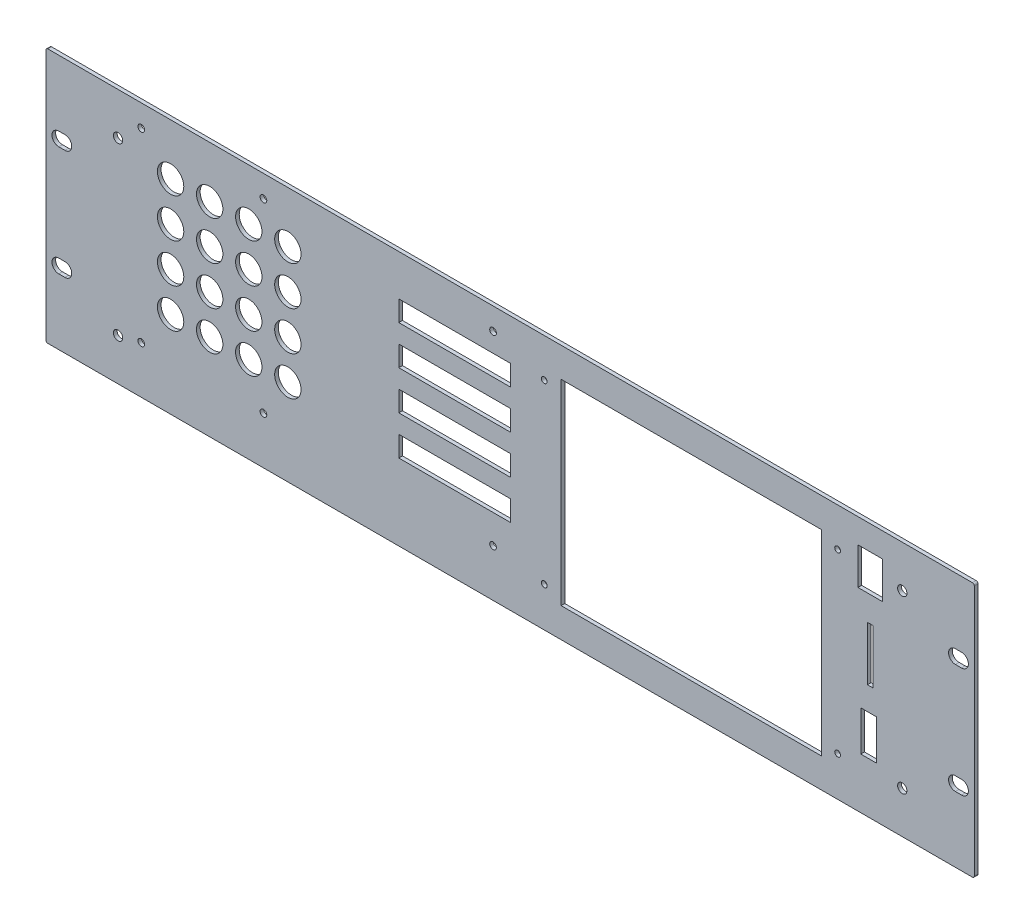
from build123d import *

# Parameters (mm, degrees)
FRONT_PANEL_DEPTH                = 1.905
SKETCH5_R                        = 2.4257
SKETCH5_R_2                      = 2.0701
FRONT_PANEL_MOUNTING_HOLES_DEPTH = 1.905
RACK_MOUNTING_SLOT_DEPTH         = 1.905
ADIO_MOUNTING_HOLES_R            = 1.7399
CUT_EXTRUDE1_DEPTH               = 2.54
SKETCH8_R                        = 6.858
BNC_SEED_HOLE_DEPTH              = 2.54
BNC_PATTERN_COUNT                = 4
BNC_PATTERN_PITCH                = 20.32
BNC_PATTERN_COUNT_DIR2           = 4
BNC_PATTERN_PITCH_DIR2           = 20.32
SKETCH9_W                        = 58.039
SKETCH9_H                        = 10.668
DIO_SEED_HOLE_DEPTH              = 2.54
DIO_PATTERN_COUNT                = 4
DIO_PATTERN_PITCH                = 20.32
LCD_VIEW_CUTOUT_W                = 135.46
LCD_VIEW_CUTOUT_H                = 101.9
LCD_CUTOUT_DEPTH                 = 2.54
LCD_MOUNT_HOLES_R                = 1.5
LCD_MOUNT_HOLE_CUT_DEPTH         = 2.54
SKETCH10_W                       = 12.9
SKETCH10_H                       = 19.2
POWER_SW_CUT_DEPTH               = 12.03
SKETCH11_W                       = 2.935387627
SKETCH11_H                       = 28.1
SKETCH11_W_2                     = 8.128
SKETCH11_H_2                     = 20.828
CUT_EXTRUDE8_DEPTH               = 2.54


# Sheet-metal steps are written as plain solids
with BuildPart() as part:
    # Sketch1 → Front Panel (new body)
    with BuildSketch(Plane.XY):
        with BuildLine():
            Line((1.016, 0), (481.584, 0))
            ThreePointArc((481.584, 0), (482.30242049, 0.29757951), (482.6, 1.016))
            Line((482.6, 1.016), (482.6, 131.572))
            ThreePointArc((482.6, 131.572), (482.30242049, 132.29042049), (481.584, 132.588))
            Line((481.584, 132.588), (1.016, 132.588))
            ThreePointArc((1.016, 132.588), (0.29757951, 132.29042049), (0, 131.572))
            Line((0, 131.572), (0, 1.016))
            ThreePointArc((0, 1.016), (0.29757951, 0.29757951), (1.016, 0))
        make_face()
    extrude(amount=FRONT_PANEL_DEPTH)

    # Sketch5 → Front Panel Mounting Holes (cut)
    with BuildSketch(Plane.XY.offset(1.905)):
        with Locations((445.135, 21.844)):
            Circle(SKETCH5_R)
        with Locations((37.465, 21.844)):
            Circle(SKETCH5_R)
        with Locations((37.465, 110.744)):
            Circle(SKETCH5_R)
        with Locations((445.135, 110.744)):
            Circle(SKETCH5_R)
        with Locations((241.3, -19.907000064)):
            Circle(SKETCH5_R_2)
    extrude(amount=-FRONT_PANEL_MOUNTING_HOLES_DEPTH, mode=Mode.SUBTRACT)

    # Sketch2 → Rack Mounting Slot (cut)
    with BuildSketch(Plane.XY.offset(1.905)):
        with BuildLine():
            Line((472.7575, 34.1503), (475.9579, 34.1503))
            ThreePointArc((475.9579, 34.1503), (479.5012, 37.6936), (475.9579, 41.2369))
            Line((475.9579, 41.2369), (472.7575, 41.2369))
            ThreePointArc((472.7575, 41.2369), (469.2142, 37.6936), (472.7575, 34.1503))
        make_face()
        with BuildLine():
            Line((9.8425, 98.4377), (6.6421, 98.4377))
            ThreePointArc((6.6421, 98.4377), (3.0988, 94.8944), (6.6421, 91.3511))
            Line((6.6421, 91.3511), (9.8425, 91.3511))
            ThreePointArc((9.8425, 91.3511), (13.3858, 94.8944), (9.8425, 98.4377))
        make_face()
        with BuildLine():
            Line((6.6421, 41.2369), (9.8425, 41.2369))
            ThreePointArc((9.8425, 41.2369), (13.3858, 37.6936), (9.8425, 34.1503))
            Line((9.8425, 34.1503), (6.6421, 34.1503))
            ThreePointArc((6.6421, 34.1503), (3.0988, 37.6936), (6.6421, 41.2369))
        make_face()
        with BuildLine():
            Line((475.9579, 91.3511), (472.7575, 91.3511))
            ThreePointArc((472.7575, 91.3511), (469.2142, 94.8944), (472.7575, 98.4377))
            Line((472.7575, 98.4377), (475.9579, 98.4377))
            ThreePointArc((475.9579, 98.4377), (479.5012, 94.8944), (475.9579, 91.3511))
        make_face()
    extrude(amount=-RACK_MOUNTING_SLOT_DEPTH, mode=Mode.SUBTRACT)

    # ADio mounting holes → Cut-Extrude1 (cut)
    with BuildSketch(Plane.XY.offset(1.905)):
        with Locations((49.53, 121.158)):
            Circle(ADIO_MOUNTING_HOLES_R)
        with Locations((113.03, 121.158)):
            Circle(ADIO_MOUNTING_HOLES_R)
        with Locations((232.41, 121.158)):
            Circle(ADIO_MOUNTING_HOLES_R)
        with Locations((49.53, 24.638)):
            Circle(ADIO_MOUNTING_HOLES_R)
        with Locations((113.03, 24.638)):
            Circle(ADIO_MOUNTING_HOLES_R)
        with Locations((232.41, 24.638)):
            Circle(ADIO_MOUNTING_HOLES_R)
    extrude(amount=-CUT_EXTRUDE1_DEPTH, mode=Mode.SUBTRACT)

    # Sketch8 → BNC seed hole (cut)
    with BuildSketch(Plane.XY.offset(1.905)):
        with Locations((64.77, 105.918)):
            Circle(SKETCH8_R)
    bnc_seed_hole = extrude(amount=-BNC_SEED_HOLE_DEPTH, mode=Mode.SUBTRACT)

    # BNC pattern: BNC seed hole 4 × 4
    with Locations(*[(i * BNC_PATTERN_PITCH, -j * BNC_PATTERN_PITCH_DIR2, 0) for i in range(BNC_PATTERN_COUNT) for j in range(BNC_PATTERN_COUNT_DIR2) if (i, j) != (0, 0)]):
        add(bnc_seed_hole, mode=Mode.SUBTRACT)

    # Sketch9 → DIO Seed Hole (cut)
    with BuildSketch(Plane.XY.offset(1.905)):
        with Locations((212.4075, 105.918)):
            Rectangle(SKETCH9_W, SKETCH9_H)
    dio_seed_hole = extrude(amount=-DIO_SEED_HOLE_DEPTH, mode=Mode.SUBTRACT)

    # DIO Pattern: DIO Seed Hole ×4
    with Locations(*[(0, -i * DIO_PATTERN_PITCH, 0) for i in range(1, DIO_PATTERN_COUNT)]):
        add(dio_seed_hole, mode=Mode.SUBTRACT)

    # LCD view cutout → LCD Cutout (cut)
    with BuildSketch(Plane.XY.offset(1.905)):
        with Locations((335.534, 66.294)):
            Rectangle(LCD_VIEW_CUTOUT_W, LCD_VIEW_CUTOUT_H)
    extrude(amount=-LCD_CUTOUT_DEPTH, mode=Mode.SUBTRACT)

    # LCD mount holes → LCD mount hole - cut (cut)
    with BuildSketch(Plane.XY.offset(1.905)):
        with Locations((259.03, 112.498)):
            Circle(LCD_MOUNT_HOLES_R)
        with Locations((411.53, 112.498)):
            Circle(LCD_MOUNT_HOLES_R)
        with Locations((259.03, 20.598)):
            Circle(LCD_MOUNT_HOLES_R)
        with Locations((411.53, 20.598)):
            Circle(LCD_MOUNT_HOLES_R)
    extrude(amount=-LCD_MOUNT_HOLE_CUT_DEPTH, mode=Mode.SUBTRACT)

    # Sketch10 → power sw - cut (cut)
    with BuildSketch(Plane.XY.offset(1.905)):
        with Locations((428.525, 110.288)):
            Rectangle(SKETCH10_W, SKETCH10_H)
    extrude(amount=-POWER_SW_CUT_DEPTH, mode=Mode.SUBTRACT)

    # Sketch11 → Cut-Extrude8 (cut)
    with BuildSketch(Plane.XY.offset(1.905)):
        with Locations((428.512093814, 73.405799856)):
            Rectangle(SKETCH11_W, SKETCH11_H)
        with Locations((427.6344, 36.825799856)):
            Rectangle(SKETCH11_W_2, SKETCH11_H_2)
    extrude(amount=-CUT_EXTRUDE8_DEPTH, mode=Mode.SUBTRACT)


solid = part.part
